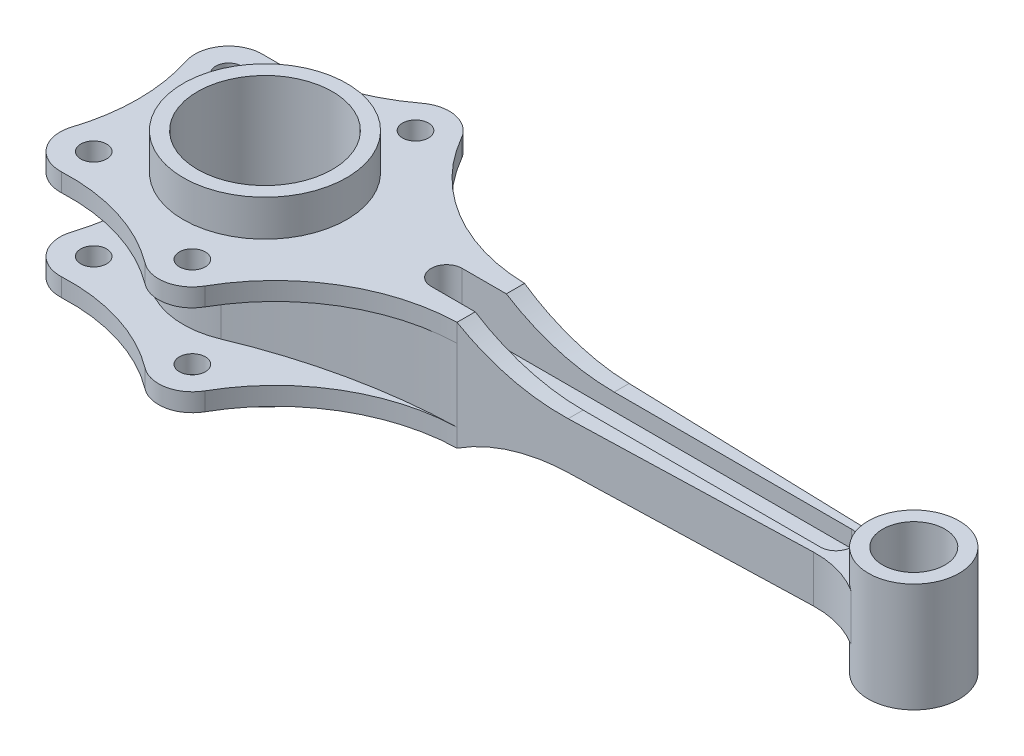
from build123d import *

# Parameters (mm, degrees)
SKETCH1_R               = 31.5
SKETCH1_R_2             = 26
BOSS_EXTRUDE1_DEPTH     = 35
SKETCH1_3_R             = 31.5
SKETCH1_3_R_2           = 26
BOSS_EXTRUDE2_DEPTH     = 21
SKETCH2_R               = 5
BOSS_EXTRUDE7_DEPTH     = 21
CUT_EXTRUDE3_DEPTH      = 250.349008072
CUT_EXTRUDE3_DEPTH_BACK = 250.349008072
SKETCH2_6_R             = 17.5
SKETCH2_6_R_2           = 12
BOSS_EXTRUDE8_DEPTH     = 21
CUT_EXTRUDE4_START      = 2.5
CUT_EXTRUDE4_DEPTH      = 18.5
CUT_EXTRUDE5_DEPTH      = 14
CUT_EXTRUDE7_DEPTH      = 276.530851267
CUT_EXTRUDE7_DEPTH_BACK = 276.530851267
SKETCH1_5_R             = 26


# Read off the part's stored shape, not the designer's step: Cut-Extrude4
with BuildPart() as part:
    # Sketch1 → Boss-Extrude1 (new, symmetric)
    with BuildSketch(Plane(origin=(0, 0, 0), x_dir=(1, 0, 0), z_dir=(0, 1, 0))):
        with Locations(Location((0, 0, 0), (0, 0, 270))):
            Circle(SKETCH1_R)
        with Locations(Location((0, 0, 0), (0, 0, 270))):
            Circle(SKETCH1_R_2, mode=Mode.SUBTRACT)
    extrude(amount=BOSS_EXTRUDE1_DEPTH, both=True)

    # Sketch1<3> → Boss-Extrude2 (add, symmetric)
    with BuildSketch(Plane(origin=(0, 0, 0), x_dir=(1, 0, 0), z_dir=(0, 1, 0))):
        with Locations(Location((0, 0, 0), (0, 0, 270))):
            Circle(SKETCH1_3_R)
        with Locations(Location((0, 0, 0), (0, 0, 270))):
            Circle(SKETCH1_3_R_2, mode=Mode.SUBTRACT)
    extrude(amount=BOSS_EXTRUDE2_DEPTH, both=True)

    # Sketch2 → Boss-Extrude7 (add, symmetric)
    with BuildSketch(Plane(origin=(0, 0, 0), x_dir=(1, 0, 0), z_dir=(0, 1, 0))):
        with BuildLine():
            Line((220.285908843, 9), (87, 13))
            ThreePointArc((87, 13), (51.867643982, 23.236099658), (26.304344234, 49.419641847))
            ThreePointArc((26.304344234, 49.419641847), (17.640533854, 55.729005498), (7.181946677, 53.386435492))
            ThreePointArc((7.181946677, 53.386435492), (-14.855989459, 42.122318837), (-39.406288617, 38.986435492))
            ThreePointArc((-39.406288617, 38.986435492), (-50.326951915, 33.896458963), (-52.376901133, 22.023529412))
            ThreePointArc((-52.376901133, 22.023529412), (-48.925892025, 0), (-52.376901133, -22.023529412))
            ThreePointArc((-52.376901133, -22.023529412), (-50.326951915, -33.896458963), (-39.406288617, -38.986435492))
            ThreePointArc((-39.406288617, -38.986435492), (-14.855989459, -42.122318837), (7.181946677, -53.386435492))
            ThreePointArc((7.181946677, -53.386435492), (17.640533854, -55.729005498), (26.304344234, -49.419641847))
            ThreePointArc((26.304344234, -49.419641847), (51.867643982, -23.236099658), (87, -13))
            Line((87, -13), (220.285908843, -9))
            ThreePointArc((220.285908843, -9), (230.798886909, -10.287807913), (240.445269919, -14.661416476))
            ThreePointArc((240.445269919, -14.661416476), (232.5, 0), (240.445269919, 14.661416476))
            ThreePointArc((240.445269919, 14.661416476), (230.798886909, 10.287807913), (220.285908843, 9))
        make_face()
        with Locations(Location((15, 43, 0), (0, 0, 90))):
            Circle(SKETCH2_R, mode=Mode.SUBTRACT)
        with Locations(Location((15, -43, 0), (0, 0, 90))):
            Circle(SKETCH2_R, mode=Mode.SUBTRACT)
        with Locations(Location((-40, -26, 0), (0, 0, 90))):
            Circle(SKETCH2_R, mode=Mode.SUBTRACT)
        with Locations(Location((-40, 26, 0), (0, 0, 90))):
            Circle(SKETCH2_R, mode=Mode.SUBTRACT)
    extrude(amount=BOSS_EXTRUDE7_DEPTH, both=True)

    # Sketch6 → Cut-Extrude3 (cut, two sides: drawn at the far end of the back side and taken through both)
    with BuildSketch(Plane.XY.offset(-CUT_EXTRUDE3_DEPTH_BACK)):
        with BuildLine():
            Line((240.445269919, 21), (220.285908843, 21))
            Line((220.285908843, 21), (87, 21))
            ThreePointArc((87, 21), (106.935911729, 12.060024019), (128.569219382, 9))
            Line((128.569219382, 9), (240.445269919, 9))
            Line((240.445269919, 9), (240.445269919, 21))
        make_face()
        with BuildLine():
            Line((240.445269919, -9), (128.569219382, -9))
            ThreePointArc((128.569219382, -9), (106.935911729, -12.060024019), (87, -21))
            Line((87, -21), (240.445269919, -21))
            Line((240.445269919, -21), (240.445269919, -9))
        make_face()
    extrude(amount=CUT_EXTRUDE3_DEPTH + CUT_EXTRUDE3_DEPTH_BACK, mode=Mode.SUBTRACT)

    # Sketch2<6> → Boss-Extrude8 (add, symmetric)
    with BuildSketch(Plane(origin=(0, 0, 0), x_dir=(1, 0, 0), z_dir=(0, 1, 0))):
        with Locations(Location((250, 0, 0), (0, 0, 270))):
            Circle(SKETCH2_6_R)
        with Locations(Location((250, 0, 0), (0, 0, 90))):
            Circle(SKETCH2_6_R_2, mode=Mode.SUBTRACT)
    extrude(amount=BOSS_EXTRUDE8_DEPTH, both=True)

    # Cut-Extrude4 outline → Cut-Extrude4 (cut)
    with BuildSketch(Plane(origin=(0, 0, 0), x_dir=(1, 0, 0), z_dir=(0, 1, 0)).offset(CUT_EXTRUDE4_START)):
        with BuildLine():
            ThreePointArc((220, -6), (226, 0), (220, 6))
            Line((220, 6), (70, 6))
            ThreePointArc((70, 6), (64, 0), (70, -6))
            Line((70, -6), (220, -6))
        make_face()
    cut_extrude4 = extrude(amount=CUT_EXTRUDE4_DEPTH, mode=Mode.SUBTRACT)

    # Mirror3: Cut-Extrude4 across plane
    add(cut_extrude4.mirror(Plane.ZX), mode=Mode.SUBTRACT)

    # Sketch9 → Cut-Extrude5 (cut, symmetric)
    with BuildSketch(Plane(origin=(0, 0, 0), x_dir=(1, 0, 0), z_dir=(0, 1, 0))):
        with BuildLine():
            ThreePointArc((87, -13), (48.833727891, -17.562334102), (12.155663261, -29.060107548))
            ThreePointArc((12.155663261, -29.060107548), (-31.5, 0), (12.155663261, 29.060107548))
            ThreePointArc((12.155663261, 29.060107548), (48.833727891, 17.562334102), (87, 13))
            ThreePointArc((87, 13), (51.867643982, 23.236099658), (26.304344234, 49.419641847))
            ThreePointArc((26.304344234, 49.419641847), (17.640533854, 55.729005498), (7.181946677, 53.386435492))
            ThreePointArc((7.181946677, 53.386435492), (-14.855989459, 42.122318837), (-39.406288617, 38.986435492))
            ThreePointArc((-39.406288617, 38.986435492), (-50.326951915, 33.896458963), (-52.376901133, 22.023529412))
            ThreePointArc((-52.376901133, 22.023529412), (-48.925892025, 0), (-52.376901133, -22.023529412))
            ThreePointArc((-52.376901133, -22.023529412), (-50.326951915, -33.896458963), (-39.406288617, -38.986435492))
            ThreePointArc((-39.406288617, -38.986435492), (-14.855989459, -42.122318837), (7.181946677, -53.386435492))
            ThreePointArc((7.181946677, -53.386435492), (17.640533854, -55.729005498), (26.304344234, -49.419641847))
            ThreePointArc((26.304344234, -49.419641847), (51.867643982, -23.236099658), (87, -13))
        make_face()
    extrude(amount=CUT_EXTRUDE5_DEPTH, both=True, mode=Mode.SUBTRACT)

    # Sketch1<5> → Cut-Extrude7 (cut, two sides: drawn at the far end of the back side and taken through both)
    with BuildSketch(Plane(origin=(0, 0, 0), x_dir=(1, 0, 0), z_dir=(0, 1, 0)).offset(-CUT_EXTRUDE7_DEPTH_BACK)):
        with Locations(Location((0, 0, 0), (0, 0, 270))):
            Circle(SKETCH1_5_R)
    extrude(amount=CUT_EXTRUDE7_DEPTH + CUT_EXTRUDE7_DEPTH_BACK, mode=Mode.SUBTRACT)


solid = part.part
